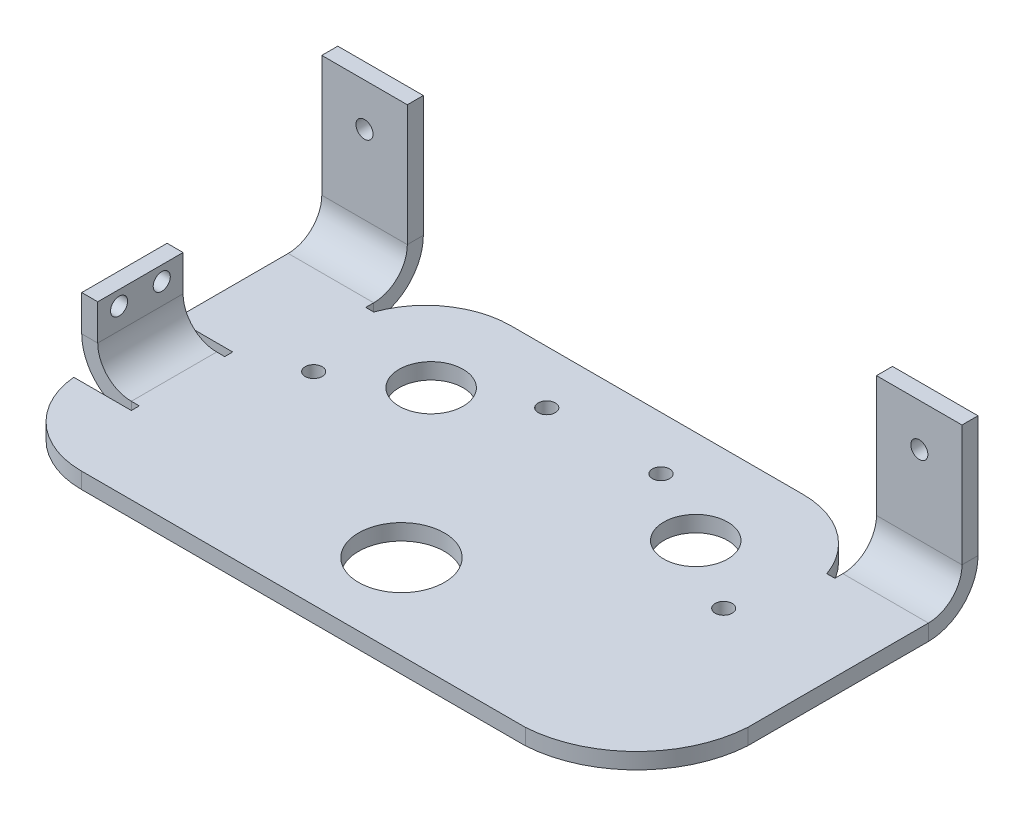
from build123d import *

# Parameters (mm, degrees)
SKETCH1_W                     = 190.5
SKETCH1_H                     = 101.6
BOSS_EXTRUDE1_DEPTH           = 1.5875
CONVERT_SOLID1_START          = -95.25
CONVERT_SOLID1_OUTLINE_W      = 3.175
CONVERT_SOLID1_OUTLINE_H      = 101.6
CONVERT_SOLID1_DEPTH          = 190.5
SKETCH30_R                    = 12.770921212
CUT_EXTRUDE6_DEPTH            = 38.1
SKETCH35_W                    = 139.601875342
SKETCH35_H                    = 6.35
CUT_EXTRUDE7_DEPTH            = 0.254
EDGE_FLANGE1_STRIP_W          = 39.05
EDGE_FLANGE1_STRIP_H          = 4.7625
EDGE_FLANGE1_STRIP_CUT_DEPTH  = 25.449062329
EDGE_FLANGE1_RELIEF_W         = 41.43125
EDGE_FLANGE1_RELIEF_H         = 2.38125
EDGE_FLANGE1_RELIEF_CUT_DEPTH = 4.7625
EDGE_FLANGE1_DEPTH            = 25.449062329
EDGE_FLANGE2_STRIP_W          = 39.05
EDGE_FLANGE2_STRIP_H          = 4.7625
EDGE_FLANGE2_STRIP_CUT_DEPTH  = 25.449062329
EDGE_FLANGE2_RELIEF_W         = 41.43125
EDGE_FLANGE2_RELIEF_H         = 2.38125
EDGE_FLANGE2_RELIEF_CUT_DEPTH = 4.7625
EDGE_FLANGE2_DEPTH            = 25.449062329
SKETCH45_W                    = 4.7625
SKETCH45_H                    = 0.000254
CUT_EXTRUDE10_DEPTH           = 25.4
EDGE_FLANGE4_STRIP_W          = 39.05
EDGE_FLANGE4_STRIP_H          = 4.7625
EDGE_FLANGE4_STRIP_CUT_DEPTH  = 25.4
EDGE_FLANGE4_RELIEF_W         = 41.43125
EDGE_FLANGE4_RELIEF_H         = 2.38125
EDGE_FLANGE4_RELIEF_CUT_DEPTH = 4.7625
EDGE_FLANGE4_DEPTH            = 25.4
FILLET9_R                     = 25.4
CUT_EXTRUDE11_DEPTH           = 25.4
FILLET10_R                    = 25.4
SKETCH53_R                    = 2.54
CUT_EXTRUDE12_DEPTH           = 4.7625
SKETCH54_R                    = 2.54
CUT_EXTRUDE13_DEPTH           = 4.7625
SKETCH55_R                    = 9.525
SKETCH55_R_2                  = 2.54
CUT_EXTRUDE14_DEPTH           = 4.7625


# Read off the part's stored shape, not the designer's step: Convert-Solid1
# Sheet-metal steps are written as plain solids
with BuildPart() as part:
    # Sketch1 → Boss-Extrude1 (new body)
    with BuildSketch(Plane(origin=(0, 0, 0), x_dir=(1, 0, 0), z_dir=(0, 1, 0))):
        Rectangle(SKETCH1_W, SKETCH1_H)
    extrude(amount=BOSS_EXTRUDE1_DEPTH)

    # Convert-Solid1 outline → Convert-Solid1 (add)
    with BuildSketch(Plane.YZ.offset(CONVERT_SOLID1_START)):
        with Locations((-1.5875, 0)):
            Rectangle(CONVERT_SOLID1_OUTLINE_W, CONVERT_SOLID1_OUTLINE_H)
    extrude(amount=CONVERT_SOLID1_DEPTH)

    # Sketch30 → Cut-Extrude6 (cut)
    with BuildSketch(Plane(origin=(0, -3.175, 0), x_dir=(-1, 0, 0), z_dir=(0, -1, 0))):
        with Locations(Location((0, -25.504506424, 0), (0, 0, 90))):
            Circle(SKETCH30_R)
    extrude(amount=-CUT_EXTRUDE6_DEPTH, mode=Mode.SUBTRACT)

    # Sketch35 → Cut-Extrude7 (cut)
    with BuildSketch(Plane(origin=(0, 0, -50.8), x_dir=(-1, 0, 0), z_dir=(0, 0, -1))):
        Rectangle(SKETCH35_W, SKETCH35_H)
    extrude(amount=-CUT_EXTRUDE7_DEPTH, mode=Mode.SUBTRACT)

    # Edge-Flange1 strip (across the edge) → Edge-Flange1 strip cut (cut)
    with BuildSketch(Plane(origin=(95.25, 1.5875, -50.8), x_dir=(0, 0, 1), z_dir=(-1, 0, 0))):
        with Locations((-4.7625, -2.38125)):
            Rectangle(EDGE_FLANGE1_STRIP_W, EDGE_FLANGE1_STRIP_H)
    extrude(amount=EDGE_FLANGE1_STRIP_CUT_DEPTH, mode=Mode.SUBTRACT)

    # Edge-Flange1 relief (on the sheet) → Edge-Flange1 relief cut (cut)
    with BuildSketch(Plane(origin=(95.25, 1.5875, -36.0375), x_dir=(0, 0, 1), z_dir=(0, 1, 0))):
        with Locations((-18.334375, -26.639687329)):
            Rectangle(EDGE_FLANGE1_RELIEF_W, EDGE_FLANGE1_RELIEF_H)
    extrude(amount=-EDGE_FLANGE1_RELIEF_CUT_DEPTH, mode=Mode.SUBTRACT)

    # Edge-Flange1 section (across the edge) → Edge-Flange1 (add)
    with BuildSketch(Plane(origin=(95.25, 1.5875, -50.8), x_dir=(0, 0, 1), z_dir=(-1, 0, 0))):
        with BuildLine():
            Line((0, 10), (0, 46.0375))
            Line((0, 46.0375), (4.7625, 46.0375))
            Line((4.7625, 46.0375), (4.7625, 10))
            ThreePointArc((4.7625, 10), (7.691432188, 2.928932188), (14.7625, 0))
            Line((14.7625, 0), (14.7625, -4.7625))
            ThreePointArc((14.7625, -4.7625), (4.323836143, -0.438663857), (0, 10))
        make_face()
    extrude(amount=EDGE_FLANGE1_DEPTH)

    # Edge-Flange2 strip (across the edge) → Edge-Flange2 strip cut (cut)
    with BuildSketch(Plane(origin=(-69.800937671, 1.5875, -50.8), x_dir=(0, 0, 1), z_dir=(-1, 0, 0))):
        with Locations((-4.7625, -2.38125)):
            Rectangle(EDGE_FLANGE2_STRIP_W, EDGE_FLANGE2_STRIP_H)
    extrude(amount=EDGE_FLANGE2_STRIP_CUT_DEPTH, mode=Mode.SUBTRACT)

    # Edge-Flange2 relief (on the sheet) → Edge-Flange2 relief cut (cut)
    with BuildSketch(Plane(origin=(-69.800937671, 1.5875, -36.0375), x_dir=(0, 0, 1), z_dir=(0, 1, 0))):
        with Locations((-18.334375, 1.190625)):
            Rectangle(EDGE_FLANGE2_RELIEF_W, EDGE_FLANGE2_RELIEF_H)
    extrude(amount=-EDGE_FLANGE2_RELIEF_CUT_DEPTH, mode=Mode.SUBTRACT)

    # Edge-Flange2 section (across the edge) → Edge-Flange2 (add)
    with BuildSketch(Plane(origin=(-69.800937671, 1.5875, -50.8), x_dir=(0, 0, 1), z_dir=(-1, 0, 0))):
        with BuildLine():
            Line((0, 10), (0, 46.0375))
            Line((0, 46.0375), (4.7625, 46.0375))
            Line((4.7625, 46.0375), (4.7625, 10))
            ThreePointArc((4.7625, 10), (7.691432188, 2.928932188), (14.7625, 0))
            Line((14.7625, 0), (14.7625, -4.7625))
            ThreePointArc((14.7625, -4.7625), (4.323836143, -0.438663857), (0, 10))
        make_face()
    extrude(amount=EDGE_FLANGE2_DEPTH)

    # Sketch45 → Cut-Extrude10 (cut)
    with BuildSketch(Plane(origin=(0, 1.5875, 0), x_dir=(1, 0, 0), z_dir=(0, 1, 0))):
        with Locations((-92.86875, -25.399873)):
            Rectangle(SKETCH45_W, SKETCH45_H)
        with Locations((-92.86875, 0.000381)):
            Rectangle(SKETCH45_W, SKETCH45_H)
    extrude(amount=-CUT_EXTRUDE10_DEPTH, mode=Mode.SUBTRACT)

    # Edge-Flange4 strip (across the edge) → Edge-Flange4 strip cut (cut)
    with BuildSketch(Plane(origin=(-95.25, 1.5875, -0.000254), x_dir=(1, 0, 0), z_dir=(0, 0, 1))):
        with Locations((-4.7625, -2.38125)):
            Rectangle(EDGE_FLANGE4_STRIP_W, EDGE_FLANGE4_STRIP_H)
    extrude(amount=EDGE_FLANGE4_STRIP_CUT_DEPTH, mode=Mode.SUBTRACT)

    # Edge-Flange4 relief (on the sheet) → Edge-Flange4 relief cut (cut)
    with BuildSketch(Plane(origin=(-80.4875, 1.5875, -0.000254), x_dir=(1, 0, 0), z_dir=(0, 1, 0))):
        with Locations((-18.334375, 1.190625)):
            Rectangle(EDGE_FLANGE4_RELIEF_W, EDGE_FLANGE4_RELIEF_H)
        with Locations((-18.334375, -26.590625)):
            Rectangle(EDGE_FLANGE4_RELIEF_W, EDGE_FLANGE4_RELIEF_H)
    extrude(amount=-EDGE_FLANGE4_RELIEF_CUT_DEPTH, mode=Mode.SUBTRACT)

    # Edge-Flange4 section (across the edge) → Edge-Flange4 (add)
    with BuildSketch(Plane(origin=(-95.25, 1.5875, -0.000254), x_dir=(1, 0, 0), z_dir=(0, 0, 1))):
        with BuildLine():
            Line((0, 10), (0, 20.6375))
            Line((0, 20.6375), (4.7625, 20.6375))
            Line((4.7625, 20.6375), (4.7625, 10))
            ThreePointArc((4.7625, 10), (7.691432188, 2.928932188), (14.7625, 0))
            Line((14.7625, 0), (14.7625, -4.7625))
            ThreePointArc((14.7625, -4.7625), (4.323836143, -0.438663857), (0, 10))
        make_face()
    extrude(amount=EDGE_FLANGE4_DEPTH)

    # Fillet9
    # the kernel refuses this fillet: 25.4 mm, written as the material it takes off along each edge
    with BuildSketch(Plane(origin=(-67.419687671, 61.417239936, -50.546), x_dir=(1, 0, 0), z_dir=(0, -1, 0))) as fillet9_piece_1:
        with BuildLine():
            CenterArc((23.931895975, 25.4), FILLET9_R, 199.575530564, 70.424469436)
            Line((0, 16.88975), (-0.478637919, 16.719545))
            ThreePointArc((-0.478637919, 16.719545), (-0.508, 8.444875), (-0.508, 0))
            Line((-0.508, 0), (0, -0.508))
            Line((0, -0.508), (23.931895975, -0.508))
            Line((23.931895975, -0.508), (23.931895975, 0))
        make_face()
    extrude(amount=124.421979873, mode=Mode.SUBTRACT)
    with BuildSketch(Plane(origin=(67.419687671, 61.417239936, -50.546), x_dir=(0, 0, 1), z_dir=(0, -1, 0))) as fillet9_piece_2:
        with BuildLine():
            CenterArc((25.4, 23.931895975), FILLET9_R, 180, 70.424469436)
            Line((0, 23.931895975), (-0.508, 23.931895975))
            Line((-0.508, 23.931895975), (-0.508, 0))
            Line((-0.508, 0), (0, -0.508))
            ThreePointArc((0, -0.508), (8.444875, -0.508), (16.719545, -0.478637919))
            Line((16.719545, -0.478637919), (16.88975, 0))
        make_face()
    extrude(amount=124.421979873, mode=Mode.SUBTRACT)

    # Sketch52 → Cut-Extrude11 (cut)
    with BuildSketch(Plane.XZ.offset(3.175)):
        with BuildLine():
            ThreePointArc((62.156767956, 50.8), (84.936935051, 40.486935051), (95.25, 17.706767956))
            Line((95.25, 17.706767956), (95.25, 50.8))
            Line((95.25, 50.8), (62.156767956, 50.8))
        make_face()
    extrude(amount=-CUT_EXTRUDE11_DEPTH, mode=Mode.SUBTRACT)

    # Fillet10
    # the kernel refuses this fillet: 25.4 mm, written as the material it takes off along each edge
    with BuildSketch(Plane(origin=(-95.25, 64.807891195, 50.8), x_dir=(1, 0, 0), z_dir=(0, -1, 0))) as fillet10_piece_1:
        with BuildLine():
            CenterArc((25.288156478, -25.4), FILLET10_R, 90, 84.621196501)
            Line((0, -23.019004), (-0.50576313, -22.97138408))
            ThreePointArc((-0.50576313, -22.97138408), (-0.508, -11.509502), (-0.508, 0))
            Line((-0.508, 0), (0, 0.508))
            Line((0, 0.508), (25.288156478, 0.508))
            Line((25.288156478, 0.508), (25.288156478, 0))
        make_face()
    extrude(amount=131.203282389, mode=Mode.SUBTRACT)

    # Sketch53 → Cut-Extrude12 (cut)
    with BuildSketch(Plane.ZY.offset(95.25)):
        with Locations(Location((6.349746, 17.9375, 0), (0, 0, 270))):
            Circle(SKETCH53_R)
        with Locations(Location((19.049746, 17.9375, 0), (0, 0, 270))):
            Circle(SKETCH53_R)
    extrude(amount=-CUT_EXTRUDE12_DEPTH, mode=Mode.SUBTRACT)

    # Sketch54 → Cut-Extrude13 (cut)
    with BuildSketch(Plane(origin=(0, 0, -50.8), x_dir=(-1, 0, 0), z_dir=(0, 0, -1))):
        with Locations(Location((-82.55, 34.925, 0), (0, 0, 90))):
            Circle(SKETCH54_R)
        with Locations(Location((82.55, 34.925, 0), (0, 0, 90))):
            Circle(SKETCH54_R)
    extrude(amount=-CUT_EXTRUDE13_DEPTH, mode=Mode.SUBTRACT)

    # Sketch55 → Cut-Extrude14 (cut)
    with BuildSketch(Plane.XZ.offset(3.175)):
        with Locations(Location((-39.37, -22.688605117, 0), (0, 0, 270))):
            Circle(SKETCH55_R)
        with Locations(Location((39.37, -22.688605117, 0), (0, 0, 270))):
            Circle(SKETCH55_R)
        with Locations(Location((-17.001810213, -34.722893033, 0), (0, 0, 270))):
            Circle(SKETCH55_R_2)
        with Locations(Location((-61.002047674, -9.376410953, 0), (0, 0, 270))):
            Circle(SKETCH55_R_2)
        with Locations(Location((61.002047674, -9.376410953, 0), (0, 0, 270))):
            Circle(SKETCH55_R_2)
        with Locations(Location((17.001810213, -34.722893033, 0), (0, 0, 270))):
            Circle(SKETCH55_R_2)
    extrude(amount=-CUT_EXTRUDE14_DEPTH, mode=Mode.SUBTRACT)


solid = part.part
